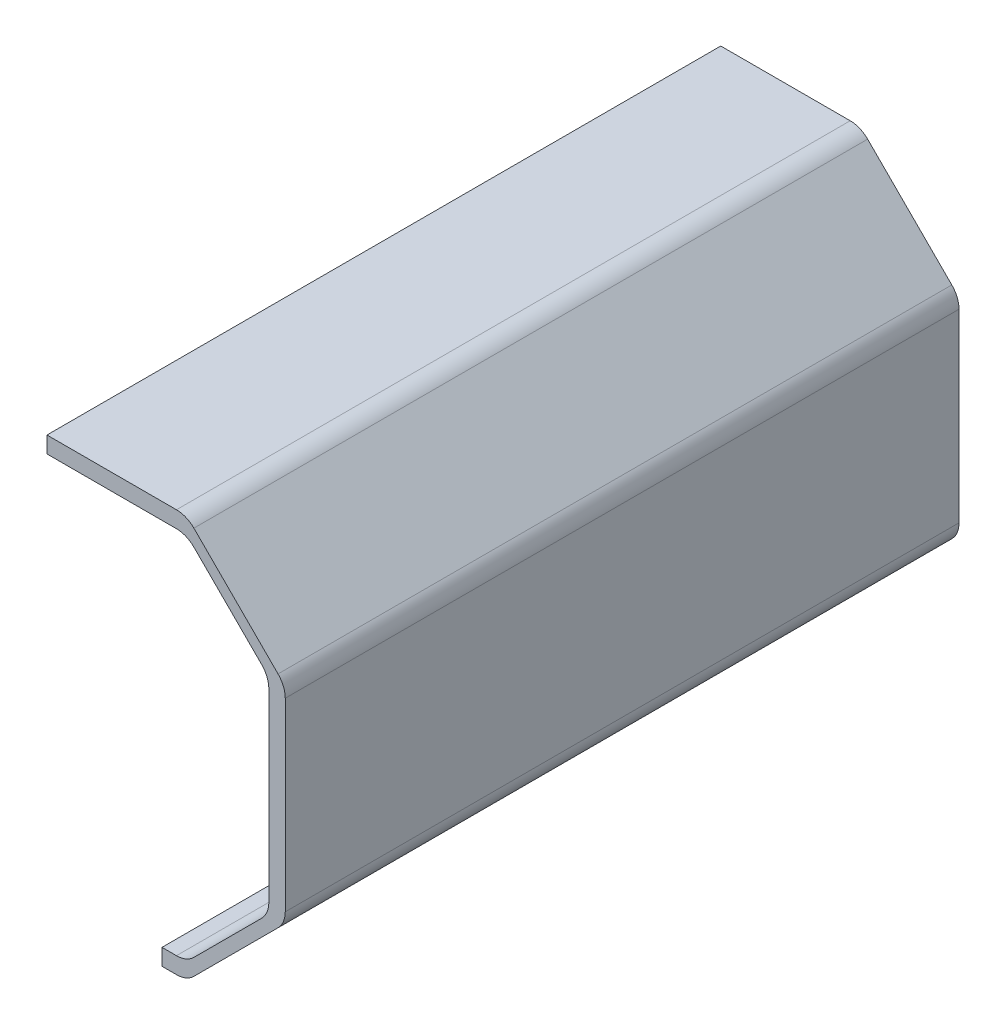
from build123d import *

# Parameters (mm, degrees)
EXTRUDE_1_DEPTH = 82
FILLET_1_R      = 3


with BuildPart() as part:
    # 草图1 → 凸台-拉伸1 (new body)
    with BuildSketch(Plane.XY):
        Polygon((0, 0), (0, 2), (3, 2), (13, 12), (13, 37), (3, 47), (-14, 47), (-14, 49), (3, 49), (15, 37), (15, 12), (3, 0), align=None)
    extrude(amount=EXTRUDE_1_DEPTH)

    # 圆角1
    fillet_1_edges = [part.edges().sort_by_distance(p)[0] for p in [
        (3, 0, 41),
        (15, 12, 41),
        (15, 37, 41),
        (3, 49, 41),
        (3, 2, 41),
        (13, 12, 41),
        (13, 37, 41),
        (3, 47, 41),
    ]]
    fillet(fillet_1_edges, radius=FILLET_1_R)


solid = part.part
